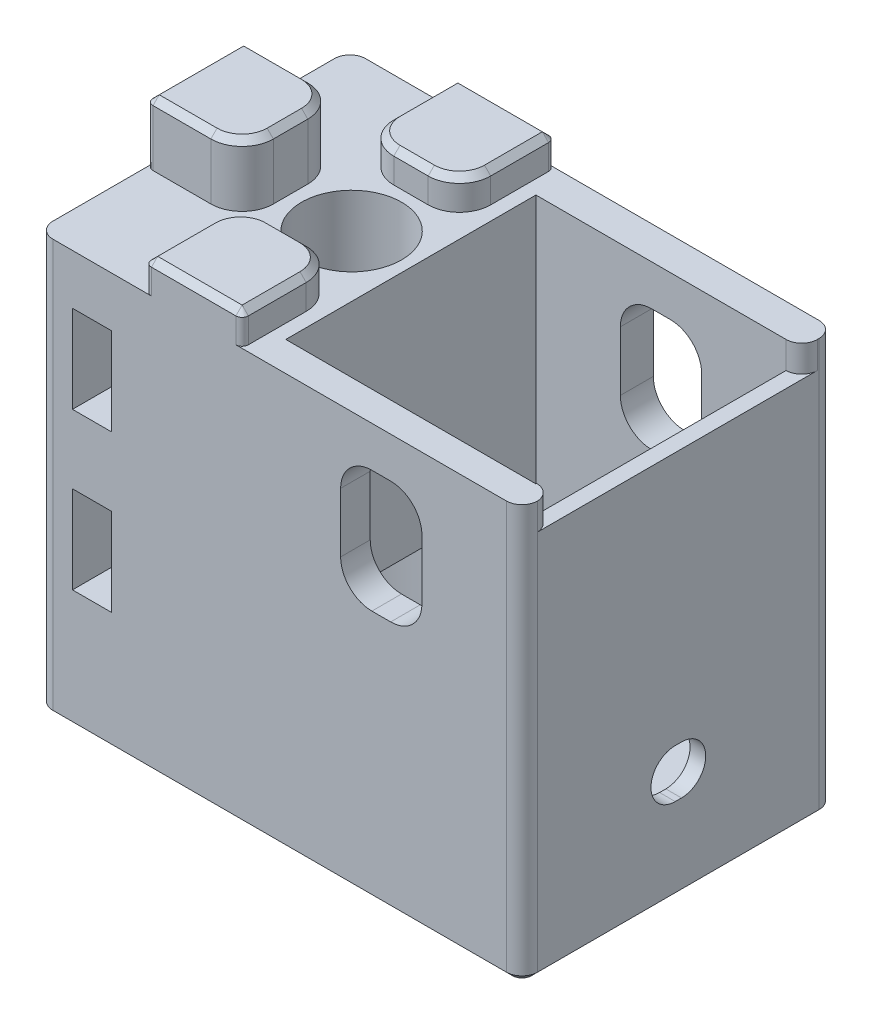
from build123d import *

# Parameters (mm, degrees)
SKETCH_1_W          = 31
SKETCH_1_H          = 26.5
EXTRUDE_1_DEPTH     = 20
SKETCH_3_W          = 16
SKETCH_3_H          = 16
CUT_EXTRUDE_1_DEPTH = 23.5
SKETCH_4_W          = 6.1
SKETCH_4_H          = 6.2
EXTRUDE_2_DEPTH     = 4
SKETCH_5_W          = 6.2
SKETCH_5_H          = 6.1
EXTRUDE_3_DEPTH     = 2
SKETCH_6_R          = 3.2
CUT_EXTRUDE_2_DEPTH = 37.640141921
CUT_EXTRUDE_3_DEPTH = 31.623724463
SKETCH_9_W          = 2.5
SKETCH_9_H          = 5.6
CUT_EXTRUDE_4_DEPTH = 8.3
SKETCH_10_W         = 1
SKETCH_10_H         = 15.952878331
CUT_EXTRUDE_5_DEPTH = 1.72
SKETCH_11_R         = 5.5
CUT_EXTRUDE_6_DEPTH = 11
SKETCH_12_R         = 2.05
CUT_EXTRUDE_7_DEPTH = 40.629534441
CUT_EXTRUDE_8_REACH = 42.725
FILLET_2_R          = 1
FILLET_3_R          = 1
SKETCH_14_R         = 1.6
CUT_EXTRUDE_9_DEPTH = 2.25
CHAMFER_2_SIZE      = 0.4
EXTRUDE_START       = 0.2
EXTRUDE_4_DEPTH     = 0.2
EXTRUDE_START_2     = 0.4
SKETCH_15_4_W       = 0.7
SKETCH_15_4_H       = 6.4
EXTRUDE_5_DEPTH     = 0.4
FILLET_4_R          = 2
FILLET_5_R          = 0.4
CHAMFER_3_SIZE      = 0.4
CHAMFER_4_SIZE      = 0.4
CHAMFER_5_SIZE      = 1


with BuildPart() as part:
    # 草图1 → 凸台-拉伸1 (new body)
    with BuildSketch(Plane.XY):
        Rectangle(SKETCH_1_W, SKETCH_1_H)
    extrude(amount=EXTRUDE_1_DEPTH)

    # 草图3 → 切除-拉伸1 (cut)
    with BuildSketch(Plane(origin=(0, 13.25, 0), x_dir=(1, 0, 0), z_dir=(0, 1, 0))):
        with Locations((6.5, -10.108217082)):
            Rectangle(SKETCH_3_W, SKETCH_3_H)
    extrude(amount=-CUT_EXTRUDE_1_DEPTH, mode=Mode.SUBTRACT)

    # 草图4 → 凸台-拉伸2 (add)
    with BuildSketch(Plane(origin=(0, 13.25, 0), x_dir=(1, 0, 0), z_dir=(0, 1, 0))):
        with Locations((-12.45, -9.9)):
            Rectangle(SKETCH_4_W, SKETCH_4_H)
    extrude(amount=EXTRUDE_2_DEPTH)

    # 草图5 → 凸台-拉伸3 (add)
    with BuildSketch(Plane(origin=(0, 13.25, 0), x_dir=(1, 0, 0), z_dir=(0, 1, 0))):
        with Locations((-5.5, -3.05)):
            Rectangle(SKETCH_5_W, SKETCH_5_H)
        with Locations((-5.5, -16.95)):
            Rectangle(SKETCH_5_W, SKETCH_5_H)
    extrude(amount=EXTRUDE_3_DEPTH)

    # 草图6 → 切除-拉伸2 (cut, through all)
    with BuildSketch(Plane(origin=(0, 13.25, 0), x_dir=(1, 0, 0), z_dir=(0, 1, 0))):
        with Locations(Location((-5.4, -10, 0), (0, 0, 270))):
            Circle(SKETCH_6_R)
    extrude(amount=-CUT_EXTRUDE_2_DEPTH, mode=Mode.SUBTRACT)

    # 草图8 → 切除-拉伸3 (cut, through all)
    with BuildSketch(Plane.XY.offset(20)):
        with BuildLine():
            Line((5.9, 10.65), (7.1, 10.65))
            ThreePointArc((7.1, 10.65), (8.514213562, 10.064213562), (9.1, 8.65))
            Line((9.1, 8.65), (9.1, 4.85))
            ThreePointArc((9.1, 4.85), (8.514213562, 3.435786438), (7.1, 2.85))
            Line((7.1, 2.85), (5.9, 2.85))
            ThreePointArc((5.9, 2.85), (4.485786438, 3.435786438), (3.9, 4.85))
            Line((3.9, 4.85), (3.9, 8.65))
            ThreePointArc((3.9, 8.65), (4.485786438, 10.064213562), (5.9, 10.65))
        make_face()
    extrude(amount=-CUT_EXTRUDE_3_DEPTH, mode=Mode.SUBTRACT)

    # 草图9 → 切除-拉伸4 (cut)
    with BuildSketch(Plane.XY.offset(20)):
        with Locations((-12, 7.25)):
            Rectangle(SKETCH_9_W, SKETCH_9_H)
        with Locations((-12, -2.75)):
            Rectangle(SKETCH_9_W, SKETCH_9_H)
    cut_extrude_4 = extrude(amount=-CUT_EXTRUDE_4_DEPTH, mode=Mode.SUBTRACT)

    # 草图10 → 切除-拉伸5 (cut)
    with BuildSketch(Plane(origin=(0, 13.25, 0), x_dir=(1, 0, 0), z_dir=(0, 1, 0))):
        with Locations((15, -10.084656247)):
            Rectangle(SKETCH_10_W, SKETCH_10_H)
    extrude(amount=-CUT_EXTRUDE_5_DEPTH, mode=Mode.SUBTRACT)

    # 草图11 → 切除-拉伸6 (cut)
    with BuildSketch(Plane.XZ.offset(13.25)):
        with Locations(Location((-5.5, 10, 0), (0, 0, 270))):
            Circle(SKETCH_11_R)
    extrude(amount=-CUT_EXTRUDE_6_DEPTH, mode=Mode.SUBTRACT)

    # 草图12 → 切除-拉伸7 (cut, through all)
    with BuildSketch(Plane(origin=(0, -13.25, 0), x_dir=(-1, 0, 0), z_dir=(0, -1, 0))):
        with Locations(Location((-7.5, -10, 0), (0, 0, 90))):
            Circle(SKETCH_12_R)
    extrude(amount=-CUT_EXTRUDE_7_DEPTH, mode=Mode.SUBTRACT)

    # 草图13 → 切除-拉伸8 (cut, up to next)
    with BuildSketch(Plane(origin=(15.5, 0, 0), x_dir=(0, 0, -1), z_dir=(1, 0, 0)), mode=Mode.PRIVATE) as cut_extrude_8_sk1:
        with BuildLine():
            Line((-10.2, -4.7), (-9.8, -4.7))
            ThreePointArc((-9.8, -4.7), (-8.25, -6.25), (-9.8, -7.8))
            Line((-9.8, -7.8), (-10.2, -7.8))
            ThreePointArc((-10.2, -7.8), (-11.75, -6.25), (-10.2, -4.7))
        make_face()
    cut_extrude_8_tool1 = extrude(cut_extrude_8_sk1.sketch, amount=-CUT_EXTRUDE_8_REACH, mode=Mode.PRIVATE) & part.part
    add(cut_extrude_8_tool1.solids().sort_by_distance((15.5, -6.25, 10))[0], mode=Mode.SUBTRACT)

    # 圆角2
    fillet_2_edges = [part.edges().sort_by_distance(p)[0] for p in [
        (15.5, 0, 20),
        (-15.5, 0, 20),
        (15.5, 0, 0),
        (-15.5, 0, 0),
    ]]
    fillet(fillet_2_edges, radius=FILLET_2_R)

    # 圆角3
    # the kernel refuses this fillet: 1 mm, written as the material it takes off along each edge
    with BuildSketch(Plane(origin=(15.5, 15.745329826, 18.061095413), x_dir=(0, 0, 1), z_dir=(0, -1, 0))) as fillet_3_piece_1:
        with BuildLine():
            CenterArc((1, 0.99813193), FILLET_3_R, 180, 86.497309331)
            Line((0, 0.99813193), (-0.02, 0.99813193))
            Line((-0.02, 0.99813193), (-0.02, 0))
            Line((-0.02, 0), (0, -0.02))
            ThreePointArc((0, -0.02), (0.469452294, -0.02), (0.937682679, -0.019962639))
            Line((0.937682679, -0.019962639), (0.938904587, 0))
        make_face()
    extrude(amount=4.215329826, mode=Mode.SUBTRACT)
    with BuildSketch(Plane(origin=(15.5, 15.75, 2.108217082), x_dir=(0, 0, -1), z_dir=(0, -1, 0))) as fillet_3_piece_2:
        with BuildLine():
            CenterArc((FILLET_3_R, -FILLET_3_R), FILLET_3_R, 90, 90)
            Line((0, -FILLET_3_R), (-FILLET_3_R * 0.02, -FILLET_3_R))
            Line((-FILLET_3_R * 0.02, -FILLET_3_R), (-FILLET_3_R * 0.02, FILLET_3_R * 0.02))
            Line((-FILLET_3_R * 0.02, FILLET_3_R * 0.02), (FILLET_3_R, FILLET_3_R * 0.02))
            Line((FILLET_3_R, FILLET_3_R * 0.02), (FILLET_3_R, 0))
        make_face()
    extrude(amount=4.22, mode=Mode.SUBTRACT)

    # 草图14 → 切除-拉伸9 (cut)
    with BuildSketch(Plane.ZY.offset(15.5)):
        with Locations((5, 7.25)):
            Circle(SKETCH_14_R)
        with Locations((15, 7.25)):
            Circle(SKETCH_14_R)
        with Locations((5, -2.75)):
            Circle(SKETCH_14_R)
        with Locations((15, -2.75)):
            Circle(SKETCH_14_R)
    extrude(amount=-CUT_EXTRUDE_9_DEPTH, mode=Mode.SUBTRACT)

    # 镜向1: 切除-拉伸4 across plane
    add(cut_extrude_4.mirror(Plane(origin=(0, 0, 10), x_dir=(1, 0, 0), z_dir=(0, 0, -1))), mode=Mode.SUBTRACT)

    # 倒角2
    chamfer_2_edges = [part.edges().sort_by_distance(p)[0] for p in [
        (0, -13.25, 20),
        (0, -13.25, 0),
        (15.5, -13.25, 10),
        (-15.5, -13.25, 10),
        (15.207106781, -13.25, 0.292893219),
        (15.207106781, -13.25, 19.707106781),
        (-15.207106781, -13.25, 0.292893219),
        (-15.207106781, -13.25, 19.707106781),
    ]]
    chamfer(chamfer_2_edges, length=CHAMFER_2_SIZE)

    # 草图15 → 凸台-拉伸4 (add)
    with BuildSketch(Plane.XZ.offset(2.25).offset(EXTRUDE_START)):
        with BuildLine():
            Line((-8.6, 13.2), (-8.6, 14.543126677))
            ThreePointArc((-8.6, 14.543126677), (-9.3457172, 13.931979046), (-9.973253849, 13.2))
            Line((-9.973253849, 13.2), (-8.6, 13.2))
        make_face()
        with BuildLine():
            ThreePointArc((-2.2, 14.4), (-5.377031258, 15.498625163), (-8.6, 14.543126677))
            Line((-8.6, 14.543126677), (-8.6, 13.2))
            Line((-8.6, 13.2), (-2.2, 13.2))
            Line((-2.2, 13.2), (-2.2, 14.4))
        make_face()
        with BuildLine():
            ThreePointArc((-1.5, 13.774917218), (-1.836643326, 14.102416103), (-2.2, 14.4))
            Line((-2.2, 14.4), (-2.2, 13.2))
            Line((-2.2, 13.2), (-1.5, 13.2))
            Line((-1.5, 13.2), (-1.5, 13.774917218))
        make_face()
        with BuildLine():
            Line((-8.6, 5.456873323), (-8.6, 6.8))
            Line((-8.6, 6.8), (-9.973253849, 6.8))
            ThreePointArc((-9.973253849, 6.8), (-9.3457172, 6.068020954), (-8.6, 5.456873323))
        make_face()
        with BuildLine():
            Line((-2.2, 6.8), (-8.6, 6.8))
            Line((-8.6, 6.8), (-8.6, 5.456873323))
            ThreePointArc((-8.6, 5.456873323), (-5.377031258, 4.501374837), (-2.2, 5.6))
            Line((-2.2, 5.6), (-2.2, 6.8))
        make_face()
        with BuildLine():
            Line((-1.5, 6.8), (-2.2, 6.8))
            Line((-2.2, 6.8), (-2.2, 5.6))
            ThreePointArc((-2.2, 5.6), (-1.836643326, 5.897583897), (-1.5, 6.225082782))
            Line((-1.5, 6.225082782), (-1.5, 6.8))
        make_face()
    extrude(amount=-EXTRUDE_4_DEPTH)

    # 草图15<4> → 凸台-拉伸5 (add)
    with BuildSketch(Plane.XZ.offset(2.25).offset(EXTRUDE_START_2)):
        with BuildLine():
            Line((-8.6, 13.2), (-8.6, 14.543126677))
            ThreePointArc((-8.6, 14.543126677), (-9.3457172, 13.931979046), (-9.973253849, 13.2))
            Line((-9.973253849, 13.2), (-8.6, 13.2))
        make_face()
        with BuildLine():
            Line((-8.6, 6.8), (-8.6, 13.2))
            Line((-8.6, 13.2), (-9.973253849, 13.2))
            ThreePointArc((-9.973253849, 13.2), (-11, 10), (-9.973253849, 6.8))
            Line((-9.973253849, 6.8), (-8.6, 6.8))
        make_face()
        with BuildLine():
            Line((-8.6, 5.456873323), (-8.6, 6.8))
            Line((-8.6, 6.8), (-9.973253849, 6.8))
            ThreePointArc((-9.973253849, 6.8), (-9.3457172, 6.068020954), (-8.6, 5.456873323))
        make_face()
        with BuildLine():
            ThreePointArc((-1.5, 13.774917218), (-1.836643326, 14.102416103), (-2.2, 14.4))
            Line((-2.2, 14.4), (-2.2, 13.2))
            Line((-2.2, 13.2), (-1.5, 13.2))
            Line((-1.5, 13.2), (-1.5, 13.774917218))
        make_face()
        with Locations((-1.85, 10)):
            Rectangle(SKETCH_15_4_W, SKETCH_15_4_H)
        with BuildLine():
            Line((-1.5, 6.8), (-2.2, 6.8))
            Line((-2.2, 6.8), (-2.2, 5.6))
            ThreePointArc((-2.2, 5.6), (-1.836643326, 5.897583897), (-1.5, 6.225082782))
            Line((-1.5, 6.225082782), (-1.5, 6.8))
        make_face()
    extrude(amount=-EXTRUDE_5_DEPTH)

    # 圆角4
    fillet_4_edges = [part.edges().sort_by_distance(p)[0] for p in [
        (-9.4, 15.25, 13),
        (-9.4, 15.25, 6.8),
        (-2.4, 14.25, 6.1),
        (-8.6, 14.25, 6.1),
        (-2.4, 14.25, 13.9),
        (-8.6, 14.25, 13.9),
    ]]
    fillet(fillet_4_edges, radius=FILLET_4_R)

    # 圆角5
    fillet_5_edges = [part.edges().sort_by_distance(p)[0] for p in [
        (-15.5, 15.25, 6.8),
        (-15.5, 15.25, 13),
        (-2.4, 14.25, 0),
        (-8.6, 14.25, 0),
        (-2.4, 14.25, 20),
        (-8.6, 14.25, 20),
    ]]
    fillet(fillet_5_edges, radius=FILLET_5_R)

    # 倒角3
    chamfer_3_edges = [part.edges().sort_by_distance(p)[0] for p in [
        (-8.6, 15.25, 17.75),
        (-5.5, 15.25, 13.9),
        (-2.985786438, 15.25, 14.485786438),
        (-8.014213562, 15.25, 14.485786438),
        (-9.4, 17.25, 9.9),
        (-13.25, 17.25, 6.8),
        (-9.985786438, 17.25, 7.385786438),
        (-9.985786438, 17.25, 12.414213562),
        (-2.4, 15.25, 2.25),
        (-5.5, 15.25, 6.1),
        (-8.014213562, 15.25, 5.514213562),
        (-2.985786438, 15.25, 5.514213562),
        (-5.5, 15.25, 20),
        (-2.4, 15.25, 17.75),
        (-2.517157288, 15.25, 19.882842712),
        (-8.482842712, 15.25, 19.882842712),
        (-5.5, 15.25, 0),
        (-8.6, 15.25, 2.25),
        (-8.482842712, 15.25, 0.117157288),
        (-2.517157288, 15.25, 0.117157288),
        (-13.25, 17.25, 13),
        (-15.5, 17.25, 9.9),
        (-15.382842712, 17.25, 6.917157288),
        (-15.382842712, 17.25, 12.882842712),
    ]]
    chamfer(chamfer_3_edges, length=CHAMFER_3_SIZE)

    # 倒角4
    chamfer_4_edges = [part.edges().sort_by_distance(p)[0] for p in [
        (-5.5, -13.25, 15.5),
    ]]
    chamfer(chamfer_4_edges, length=CHAMFER_4_SIZE)

    # 倒角5
    chamfer_5_edges = [part.edges().sort_by_distance(p)[0] for p in [
        (7.5, -13.25, 12.05),
    ]]
    chamfer(chamfer_5_edges, length=CHAMFER_5_SIZE)


solid = part.part
